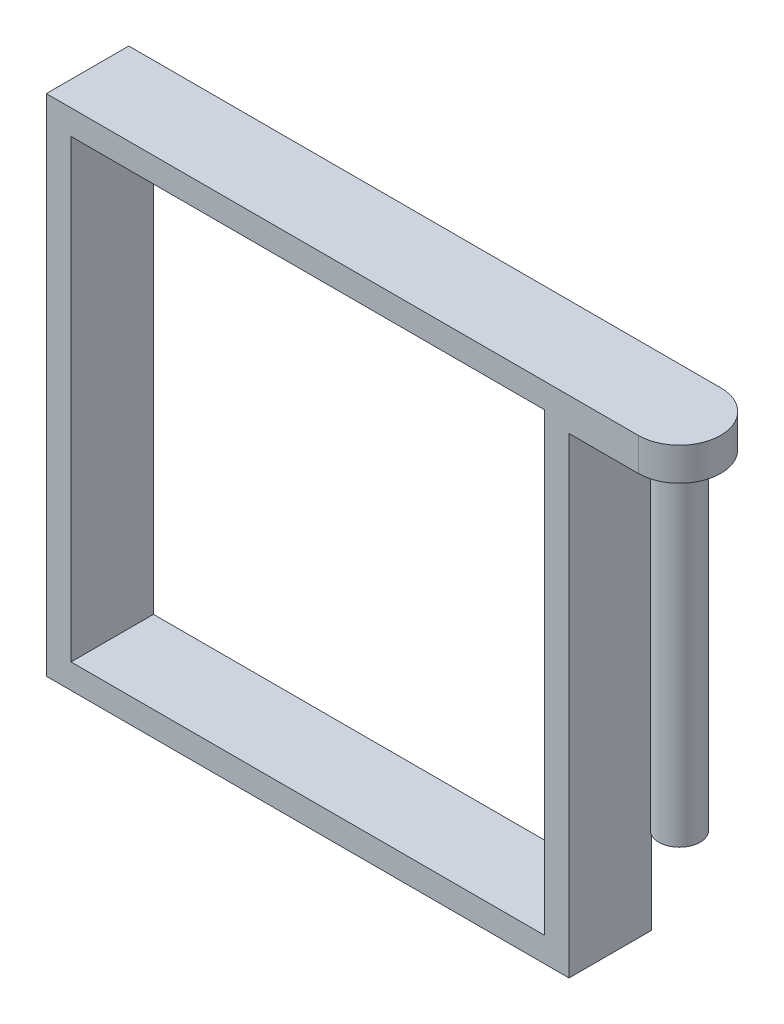
from build123d import *

# Parameters (mm, degrees)
SKETCH1_W           = 80.518
SKETCH1_H           = 77.724
SKETCH1_W_2         = 72.898
SKETCH1_H_2         = 70.104
BOSS_EXTRUDE1_DEPTH = 12.7
BOSS_EXTRUDE4_DEPTH = 5.08
SKETCH6_R           = 3.175
BOSS_EXTRUDE5_DEPTH = 50.8
SKETCH7_W           = 2.451601238
SKETCH7_H           = 1.408366668
BOSS_EXTRUDE6_DEPTH = 2.54


with BuildPart() as part:
    # Sketch1 → Boss-Extrude1 (new body)
    with BuildSketch(Plane.XY):
        with Locations((36.449, 35.052)):
            Rectangle(SKETCH1_W, SKETCH1_H)
        with Locations((36.449, 35.052)):
            Rectangle(SKETCH1_W_2, SKETCH1_H_2, mode=Mode.SUBTRACT)
    extrude(amount=BOSS_EXTRUDE1_DEPTH)

    # Sketch5 → Boss-Extrude4 (add)
    with BuildSketch(Plane(origin=(0, 73.914, 0), x_dir=(1, 0, 0), z_dir=(0, 1, 0))):
        with BuildLine():
            Line((87.376, 0), (76.708, 0))
            Line((76.708, 0), (76.708, -12.7))
            Line((76.708, -12.7), (87.376, -12.7))
            ThreePointArc((87.376, -12.7), (93.726, -6.35), (87.376, 0))
        make_face()
    extrude(amount=-BOSS_EXTRUDE4_DEPTH)

    # Sketch6 → Boss-Extrude5 (add)
    with BuildSketch(Plane.XZ.offset(-68.834)):
        with Locations((87.376, 6.35)):
            Circle(SKETCH6_R)
    extrude(amount=BOSS_EXTRUDE5_DEPTH)

    # Sketch7 → Boss-Extrude6 (add)
    with BuildSketch(Plane.XZ.offset(-68.834)):
        with Locations((84.757403423, 5.645816666)):
            Rectangle(SKETCH7_W, SKETCH7_H)
    extrude(amount=BOSS_EXTRUDE6_DEPTH)


solid = part.part
